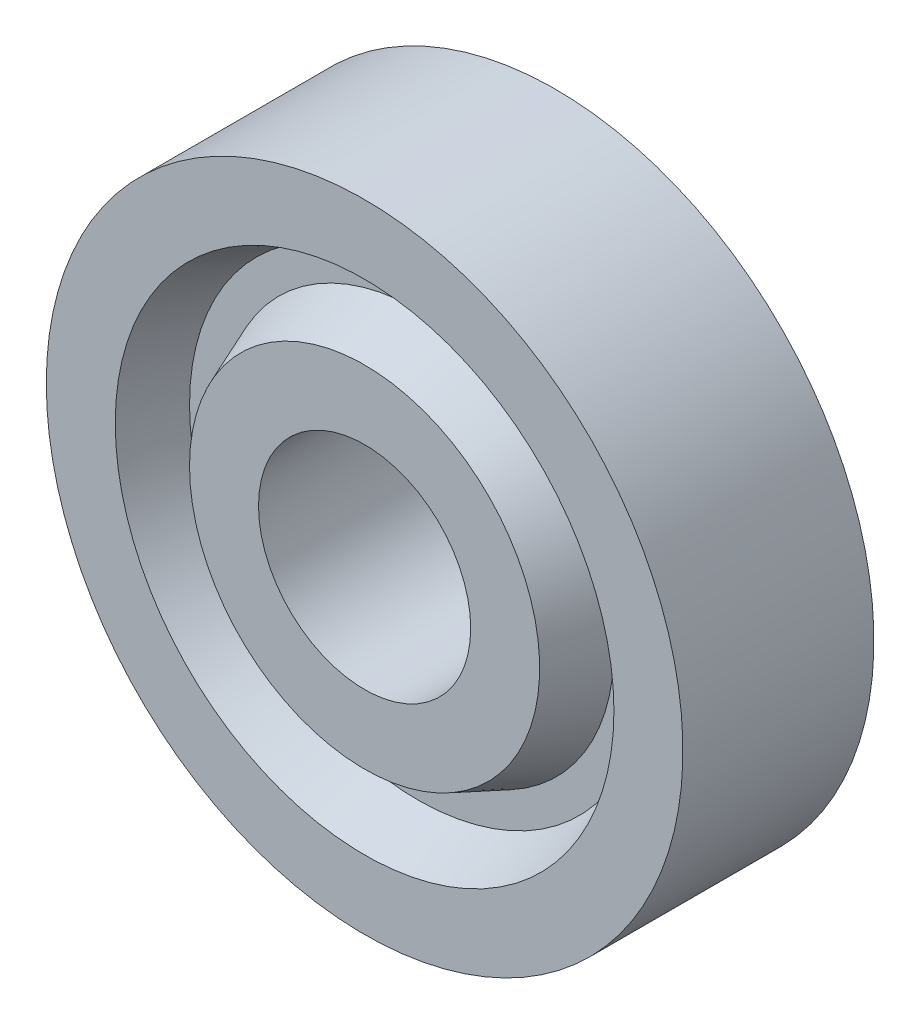
from build123d import *


with BuildPart() as part:
    # Sketch1 → Revolve1 (revolve)
    with BuildSketch(Plane(origin=(0, 0, 0), x_dir=(1, 0, 0), z_dir=(0, 1, 0))):
        Polygon((8.25, 4.5), (9.25, 2), (10.75, 2), (11.75, 4.5), (15, 4.5), (15, -4.5), (11.75, -4.5), (10.75, -2), (9.25, -2), (8.25, -4.5), (5, -4.5), (5, 4.5), align=None)
    revolve(axis=Axis((0, 0, -28.911106653), (0, 0, 1)))


solid = part.part
